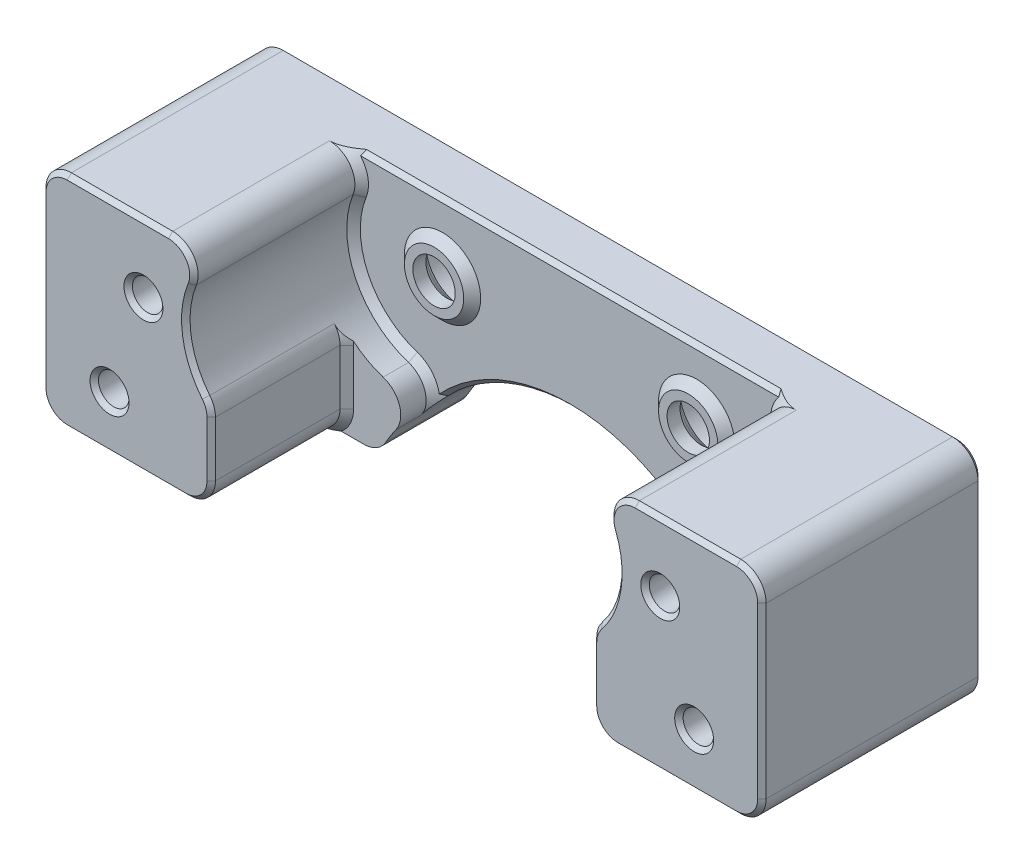
from build123d import *

# Parameters (mm, degrees)
AUFSATZ_LINEAR_AUSTRAGEN1_DEPTH = 10
AUFSATZ_LINEAR_AUSTRAGEN2_DEPTH = 16
SCHNITT_LINEAR_START            = -3.8
SCHNITT_LINEAR_AUSTRAGEN1_DEPTH = 3.8
SKIZZE4_R                       = 2.500000000000343
SKIZZE4_R_2                     = 2.499999999999612
SCHNITT_LINEAR_AUSTRAGEN2_DEPTH = 56.6622852567163
SKIZZE5_R                       = 4.25000000000047
SKIZZE5_R_2                     = 4.250000000000002
SCHNITT_LINEAR_AUSTRAGEN3_DEPTH = 4.8
FASE1_SIZE                      = 0.87
AUFSATZ_LINEAR_START            = 1
SKIZZE6_R                       = 3.500000000000343
SKIZZE6_R_2                     = 2.500000000000343
SKIZZE6_R_3                     = 3.499999999999613
SKIZZE6_R_4                     = 2.499999999999612
AUFSATZ_LINEAR_AUSTRAGEN3_DEPTH = 1
FASE2_SIZE                      = 1
SKIZZE7_R                       = 1.8000000000000005
SKIZZE7_R_2                     = 1.8000000000000007
SKIZZE7_R_3                     = 1.8000000000000047
SKIZZE7_R_4                     = 1.7999999999999936
SCHNITT_LINEAR_AUSTRAGEN4_DEPTH = 59.15711478400557
SKIZZE7_3_R                     = 3.149999999999999
SKIZZE7_3_R_2                   = 1.8000000000000005
SKIZZE7_3_R_3                   = 3.149999999999996
SKIZZE7_3_R_4                   = 1.8000000000000047
SKIZZE7_3_R_5                   = 1.8000000000000007
SKIZZE7_3_R_6                   = 3.1499999999999924
SKIZZE7_3_R_7                   = 1.7999999999999936
SCHNITT_LINEAR_AUSTRAGEN5_DEPTH = 20
FASE3_SIZE                      = 0.67
VERRUNDUNG1_R                   = 3
FASE4_SIZE                      = 0.8
FASE5_SIZE                      = 0.5


# Some blends are built 0.0001 mm under size
with BuildPart() as part:
    # Skizze1 → Aufsatz-Linear austragen1 (new body)
    with BuildSketch(Plane.XY):
        with BuildLine():
            Line((0, 29.999999999999986), (-42.5, 29.999999999999986))
            Line((-42.5, 29.999999999999986), (-42.5, 3.9999999999999862))
            Line((-42.5, 3.9999999999999862), (-18.654758106177756, 3.9999999999999862))
            ThreePointArc((-18.654758106177756, 3.9999999999999862), (-3.26e-14, 16.00000000000006), (18.654758106177756, 3.9999999999999862))
            Line((18.654758106177756, 3.9999999999999862), (42.5, 3.9999999999999862))
            Line((42.5, 3.9999999999999862), (42.5, 29.999999999999986))
            Line((42.5, 29.999999999999986), (0, 29.999999999999986))
        make_face()
    extrude(amount=AUFSATZ_LINEAR_AUSTRAGEN1_DEPTH)

    # Skizze2 → Aufsatz-Linear austragen2 (add)
    with BuildSketch(Plane.XY.offset(10)):
        with BuildLine():
            Line((-42.5, 29.999999999999986), (-42.5, 3.9999999999999862))
            Line((-42.5, 3.9999999999999862), (-22.5, 3.9999999999999862))
            Line((-22.5, 3.9999999999999862), (-22.5, 14.651530771650462))
            ThreePointArc((-22.5, 14.651530771650462), (-25.489119797069538, 22.477876430390648), (-21.800735254367645, 29.999999999999986))
            Line((-21.800735254367645, 29.999999999999986), (-42.5, 29.999999999999986))
        make_face()
        with BuildLine():
            Line((21.800735254367645, 29.999999999999986), (42.5, 29.999999999999986))
            Line((42.5, 29.999999999999986), (42.5, 3.9999999999999862))
            Line((42.5, 3.9999999999999862), (22.5, 3.9999999999999862))
            Line((22.5, 3.9999999999999862), (22.5, 14.651530771650462))
            ThreePointArc((22.5, 14.651530771650462), (25.489119797069538, 22.477876430390655), (21.800735254367645, 29.999999999999986))
        make_face()
    extrude(amount=AUFSATZ_LINEAR_AUSTRAGEN2_DEPTH)

    # Skizze3 → Schnitt-Linear austragen1 (cut)
    with BuildSketch(Plane.XY.offset(10).offset(SCHNITT_LINEAR_START)):
        with BuildLine():
            Line((-21.80073525436765, 29.999999999999986), (21.80073525436765, 29.999999999999986))
            ThreePointArc((21.80073525436765, 29.999999999999986), (25.489119797069538, 22.47787643039065), (22.5, 14.651530771650462))
            ThreePointArc((22.5, 14.651530771650462), (19.067620502353286, 12.319893417485742), (14.999999999999947, 11.499999999999947))
            Line((14.999999999999947, 11.499999999999947), (-14.999999999999947, 11.499999999999947))
            ThreePointArc((-14.999999999999947, 11.499999999999947), (-19.067620502353286, 12.319893417485742), (-22.5, 14.651530771650462))
            ThreePointArc((-22.5, 14.651530771650462), (-25.489119797069538, 22.477876430390648), (-21.80073525436765, 29.999999999999986))
        make_face()
    extrude(amount=SCHNITT_LINEAR_AUSTRAGEN1_DEPTH, mode=Mode.SUBTRACT)

    # Skizze4 → Schnitt-Linear austragen2 (cut, through all)
    with BuildSketch(Plane.XY.offset(6.199999999998522)):
        with Locations((-15.000000000000346, 22.000000000000096)):
            Circle(SKIZZE4_R)
        with Locations((15.000000000000384, 21.999999999999854)):
            Circle(SKIZZE4_R_2)
    extrude(amount=-SCHNITT_LINEAR_AUSTRAGEN2_DEPTH, mode=Mode.SUBTRACT)

    # Skizze5 → Schnitt-Linear austragen3 (cut)
    with BuildSketch(Plane(origin=(0, 0, 0), x_dir=(-1, 0, 0), z_dir=(0, 0, -1))):
        with Locations((-15.000000000000384, 21.99999999999986)):
            Circle(SKIZZE5_R)
        with Locations((14.999999999999947, 21.99999999999997)):
            Circle(SKIZZE5_R_2)
    extrude(amount=-SCHNITT_LINEAR_AUSTRAGEN3_DEPTH, mode=Mode.SUBTRACT)

    # Fase1
    fase1_edges = [part.edges().sort_by_distance(p)[0] for p in [
        (19.250000000000853, 21.99999999999986, 4.8),
        (12.500000000000771, 21.99999999999986, 4.8),
        (-10.749999999999945, 21.99999999999997, 4.8),
        (-17.50000000000069, 22.000000000000103, 4.8),
    ]]
    chamfer(fase1_edges, length=FASE1_SIZE)

    # Skizze6 → Aufsatz-Linear austragen3 (add)
    # profile 1 of 2: a face of its own
    with BuildSketch(Plane.XY.offset(6.199999999998522).offset(AUFSATZ_LINEAR_START)):
        with Locations(Location((-15.000000000000346, 22.000000000000096, 0), (0, 0, 90))):
            Circle(SKIZZE6_R)
        with Locations((-15.000000000000346, 22.000000000000096)):
            Circle(SKIZZE6_R_2, mode=Mode.SUBTRACT)
    # profile 2 of 2: a face of its own
    with BuildSketch(Plane.XY.offset(6.199999999998522).offset(AUFSATZ_LINEAR_START)):
        with Locations(Location((15.000000000000384, 21.999999999999854, 0), (0, 0, 90))):
            Circle(SKIZZE6_R_3)
        with Locations((15.000000000000384, 21.999999999999854)):
            Circle(SKIZZE6_R_4, mode=Mode.SUBTRACT)
    extrude(amount=-AUFSATZ_LINEAR_AUSTRAGEN3_DEPTH)

    # Fase2
    fase2_edges = [part.edges().sort_by_distance(p)[0] for p in [
        (-15.000000000000346, 18.49999999999976, 6.199999999998522),
        (15.000000000000384, 18.50000000000025, 6.199999999998522),
    ]]
    chamfer(fase2_edges, length=FASE2_SIZE - 0.0001)  # a hair under: the kernel refuses the full size

    # Skizze7 → Schnitt-Linear austragen4 (cut, through all)
    with BuildSketch(Plane(origin=(0, 0, 0), x_dir=(-1, 0, 0), z_dir=(0, 0, -1))):
        with Locations((-30.500000000000004, 22)):
            Circle(SKIZZE7_R)
        with Locations((-34.5, 10.373719314951785)):
            Circle(SKIZZE7_R_2)
        with Locations((30.500000000000004, 22.000000000000007)):
            Circle(SKIZZE7_R_3)
        with Locations((34.5, 10.373719314951794)):
            Circle(SKIZZE7_R_4)
    extrude(amount=-SCHNITT_LINEAR_AUSTRAGEN4_DEPTH, mode=Mode.SUBTRACT)

    # Skizze7<3> → Schnitt-Linear austragen5 (cut)
    # profile 1 of 4: a face of its own
    with BuildSketch(Plane(origin=(0, 0, 0), x_dir=(-1, 0, 0), z_dir=(0, 0, -1))):
        with Locations((-30.500000000000004, 22)):
            Circle(SKIZZE7_3_R)
        with Locations((-30.500000000000004, 22)):
            Circle(SKIZZE7_3_R_2, mode=Mode.SUBTRACT)
    # profile 2 of 4: a face of its own
    with BuildSketch(Plane(origin=(0, 0, 0), x_dir=(-1, 0, 0), z_dir=(0, 0, -1))):
        with Locations((30.500000000000004, 22.000000000000007)):
            Circle(SKIZZE7_3_R_3)
        with Locations((30.500000000000004, 22.000000000000007)):
            Circle(SKIZZE7_3_R_4, mode=Mode.SUBTRACT)
    # profile 3 of 4: a face of its own
    with BuildSketch(Plane(origin=(0, 0, 0), x_dir=(-1, 0, 0), z_dir=(0, 0, -1))):
        with Locations((-34.5, 10.373719314951785)):
            Circle(SKIZZE7_3_R)
        with Locations((-34.5, 10.373719314951785)):
            Circle(SKIZZE7_3_R_5, mode=Mode.SUBTRACT)
    # profile 4 of 4: a face of its own
    with BuildSketch(Plane(origin=(0, 0, 0), x_dir=(-1, 0, 0), z_dir=(0, 0, -1))):
        with Locations((34.5, 10.373719314951794)):
            Circle(SKIZZE7_3_R_6)
        with Locations((34.5, 10.373719314951794)):
            Circle(SKIZZE7_3_R_7, mode=Mode.SUBTRACT)
    extrude(amount=-SCHNITT_LINEAR_AUSTRAGEN5_DEPTH, mode=Mode.SUBTRACT)

    # Fase3
    fase3_edges = [part.edges().sort_by_distance(p)[0] for p in [
        (-28.7, 22.000000000000007, 20),
        (-27.35000000000001, 22.000000000000007, 20),
        (36.3, 10.373719314951785, 20),
        (37.65, 10.373719314951785, 20),
        (-32.7, 10.373719314951794, 20),
        (-31.35000000000001, 10.373719314951794, 20),
        (32.300000000000004, 22, 20),
        (33.650000000000006, 22, 20),
    ]]
    chamfer(fase3_edges, length=FASE3_SIZE)

    # Verrundung1
    # the kernel refuses this fillet: 3 mm, written as the material it takes off along each edge
    with BuildSketch(Plane(origin=(22.5, 3.9999999999999862, 10), x_dir=(1, -1.5e-16, 0), z_dir=(0, 0, 1))) as verrundung1_piece_1:
        with BuildLine():
            CenterArc((VERRUNDUNG1_R, VERRUNDUNG1_R), VERRUNDUNG1_R, 180, 90)
            Line((-4.4e-16, VERRUNDUNG1_R), (0, 0))
            Line((0, 0), (VERRUNDUNG1_R, 0))
        make_face()
    extrude(amount=23.5, mode=Mode.SUBTRACT)
    with BuildSketch(Plane(origin=(18.65475810617776, 3.9999999999999893, -4.597858564353903), x_dir=(-0.4523951415061349, 0.8918176023950436, 0), z_dir=(0, 0, 1))) as verrundung1_piece_2:
        with BuildLine():
            CenterArc((1.843433256846694, -2.9973659049238517), VERRUNDUNG1_R, 92.40117884405109, 60.70136326071929)
            Line((-0.8320195503384352, -1.6401804804054438), (0, 0))
            ThreePointArc((0, 0), (0.8588723128490288, -0.01799964968701035), (1.7177446256980617, -1e-16))
        make_face()
    extrude(amount=19.195717128707805, mode=Mode.SUBTRACT)
    with BuildSketch(Plane(origin=(-18.65475810617776, 3.9999999999999862, -4.5978585643539205), x_dir=(-1, -2.4e-16, 0), z_dir=(0, 0, 1))) as verrundung1_piece_3:
        with BuildLine():
            CenterArc((1.8391434257415675, -3), VERRUNDUNG1_R, 89.99999999999999, 60.70136326071939)
            ThreePointArc((-0.7770993230140743, -1.531914893617022), (-0.3724972570792177, -0.7741004008757256), (0, 0))
            Line((0, 0), (1.8391434257415682, 0))
        make_face()
    extrude(amount=19.19571712870784, mode=Mode.SUBTRACT)
    with BuildSketch(Plane(origin=(-22.5, 3.9999999999999862, 10), x_dir=(0, 1, 0), z_dir=(0, 0, 1))) as verrundung1_piece_4:
        with BuildLine():
            CenterArc((VERRUNDUNG1_R, VERRUNDUNG1_R), VERRUNDUNG1_R, 180, 90)
            Line((-4.4e-16, VERRUNDUNG1_R), (0, 0))
            Line((0, 0), (VERRUNDUNG1_R, 0))
        make_face()
    extrude(amount=23.5, mode=Mode.SUBTRACT)
    with BuildSketch(Plane(origin=(-22.5, 14.65153077165046, 10), x_dir=(-0.6649550224740771, 0.7468834032742324, 0), z_dir=(0, 0, 1))) as verrundung1_piece_5:
        with BuildLine():
            CenterArc((1.1457989430171323, 2.9965791558411374), VERRUNDUNG1_R, 228.3211250669131, 38.94244126898127)
            Line((-0.8490661244051058, 0.755928946018446), (0, 0))
            ThreePointArc((0, 0), (0.5012870375699956, 0.01197295455602352), (1.002574075139996, -4e-17))
        make_face()
    extrude(amount=18.842030364722625, mode=Mode.SUBTRACT)
    with BuildSketch(Plane(origin=(22.5, 14.65153077165046, 10), x_dir=(0.6649550224740782, 0.7468834032742312, 0), z_dir=(0, 0, 1))) as verrundung1_piece_6:
        with BuildLine():
            CenterArc((1.1457989430171456, -2.9965791558411365), VERRUNDUNG1_R, 92.7364336641057, 38.94244126898133)
            Line((-0.849066124405097, -0.7559289460184502), (0, 0))
            ThreePointArc((0, 0), (0.5012870375699969, -0.01197295455602155), (1.0025740751400045, -8e-17))
        make_face()
    extrude(amount=18.842030364722614, mode=Mode.SUBTRACT)
    with BuildSketch(Plane(origin=(42.5, 3.9999999999999862, -7.499999999999999), x_dir=(0, 1, 0), z_dir=(0, 0, 1))) as verrundung1_piece_7:
        with BuildLine():
            CenterArc((VERRUNDUNG1_R, VERRUNDUNG1_R), VERRUNDUNG1_R, 180, 90)
            Line((-4.4e-16, VERRUNDUNG1_R), (0, 0))
            Line((0, 0), (VERRUNDUNG1_R, 0))
        make_face()
    extrude(amount=41, mode=Mode.SUBTRACT)
    with BuildSketch(Plane(origin=(-42.5, 3.999999999999986, 33.5), x_dir=(0, 1, 0), z_dir=(0, 0, -1))) as verrundung1_piece_8:
        with BuildLine():
            CenterArc((VERRUNDUNG1_R, VERRUNDUNG1_R), VERRUNDUNG1_R, 180, 90)
            Line((0, VERRUNDUNG1_R), (0, 0))
            Line((0, 0), (VERRUNDUNG1_R, 0))
        make_face()
    extrude(amount=41, mode=Mode.SUBTRACT)
    with BuildSketch(Plane(origin=(42.5, 29.999999999999986, -7.499999999999999), x_dir=(-1, 0, 0), z_dir=(0, 0, 1))) as verrundung1_piece_9:
        with BuildLine():
            CenterArc((VERRUNDUNG1_R, VERRUNDUNG1_R), VERRUNDUNG1_R, 180, 90)
            Line((0, VERRUNDUNG1_R), (0, 0))
            Line((0, 0), (VERRUNDUNG1_R, 0))
        make_face()
    extrude(amount=41, mode=Mode.SUBTRACT)
    with BuildSketch(Plane(origin=(-42.5, 29.999999999999986, -7.499999999999999), x_dir=(1, 0, 0), z_dir=(0, 0, 1))) as verrundung1_piece_10:
        with BuildLine():
            CenterArc((VERRUNDUNG1_R, -VERRUNDUNG1_R), VERRUNDUNG1_R, 90, 90)
            Line((0, -VERRUNDUNG1_R), (0, 0))
            Line((0, 0), (VERRUNDUNG1_R, 0))
        make_face()
    extrude(amount=41, mode=Mode.SUBTRACT)
    with BuildSketch(Plane(origin=(-21.80073525436761, 29.999999999999986, 40.34800237404184), x_dir=(-1, 0, 1.8e-16), z_dir=(-1.8e-16, 0, -1))) as verrundung1_piece_11:
        with BuildLine():
            CenterArc((5.739200949616773, -3), VERRUNDUNG1_R, 90, 111.73846079152068)
            ThreePointArc((2.952548459842454, -4.111111111111121), (1.727699223599764, -1.8749852771592543), (0, 0))
            Line((0, 0), (5.739200949616773, 0))
        make_face()
    extrude(amount=34.14800237404184, mode=Mode.SUBTRACT)
    with BuildSketch(Plane(origin=(21.800735254367655, 29.999999999999986, 40.34800237404188), x_dir=(1, 0, 3.6e-16), z_dir=(3.6e-16, 0, -1))) as verrundung1_piece_12:
        with BuildLine():
            CenterArc((5.739200949616741, 3), VERRUNDUNG1_R, 158.26153920847946, 111.73846079152054)
            ThreePointArc((2.9525484598424185, 4.111111111111114), (1.7276992235997461, 1.8749852771592543), (0, 0))
            Line((0, 0), (5.739200949616741, 0))
        make_face()
    extrude(amount=34.14800237404188, mode=Mode.SUBTRACT)
    with BuildSketch(Plane(origin=(-12.816005617976494, 11.499999999999947, 24.08995299864942), x_dir=(-0.9956736487572149, 0.09291924004475213, 0), z_dir=(0, 0, -1))) as verrundung1_piece_13:
        with BuildLine():
            CenterArc((6.069056233511456, -2.9290394896317506), VERRUNDUNG1_R, 102.48662742722865, 107.68493153871188)
            Line((3.475483065378992, -4.4368120923617935), (3.216125748565745, -4.587589352634797))
            ThreePointArc((3.216125748565745, -4.587589352634797), (1.6547741109386078, -2.2833968240796914), (-0.20849658902721374, -0.21570621772220028))
            Line((-0.20849658902721374, -0.21570621772220028), (0.02787577201342571, 0.2987020946271652))
            ThreePointArc((0.02787577201342571, 0.2987020946271652), (2.202421427227976, 0.09576699638753784), (5.3555574749315245, 0.2929039489631753))
            Line((5.3555574749315245, 0.2929039489631753), (5.42042099843879, 1e-17))
        make_face()
    extrude(amount=17.88995299864942, mode=Mode.SUBTRACT)
    with BuildSketch(Plane(origin=(12.816005617976488, 11.499999999999945, 24.089952998649423), x_dir=(0.6871407081901991, -0.7265243610147367, 0), z_dir=(0, 0, -1))) as verrundung1_piece_14:
        with BuildLine():
            CenterArc((6.0483700677129235, -2.9715207253762985), VERRUNDUNG1_R, 97.90106492608787, 107.68493153871174)
            Line((3.342555753930557, -4.267116688371888), (3.0719743225523213, -4.396676284671448))
            ThreePointArc((3.0719743225523213, -4.396676284671448), (1.282754138042594, -1.7928673353164282), (-0.21795730830442153, -0.20614221245706021))
            Line((-0.21795730830442153, -0.20614221245706021), (0.0412388868253141, 0.2971520725376302))
            ThreePointArc((0.0412388868253141, 0.2971520725376302), (2.817990599729887, 0.10539162340470797), (5.5947423126344535, 0.2971520725376298))
            Line((5.5947423126344535, 0.2971520725376298), (5.635981199459769, -6e-17))
        make_face()
    extrude(amount=17.889952998649424, mode=Mode.SUBTRACT)

    # Fase4
    # the kernel refuses this chamfer: 0.8 mm, written as the material it adds along each edge
    with BuildSketch(Plane(origin=(22.5, 7, 10), x_dir=(-0.9996219169112966, 0, -0.027495876610587302), z_dir=(0, 1, 0))) as fase4_piece_1:
        Polygon((FASE4_SIZE * 0.999621916911, FASE4_SIZE * 0.0274958766106), (-FASE4_SIZE * 0.0274958766106, FASE4_SIZE * 0.999621916911), (0, 0), align=None)
    extrude(amount=6.514718625761132)
    with BuildSketch(Plane(origin=(-22.5, 7, 10), x_dir=(0.9996219169112966, 0, -0.02749587661058718), z_dir=(0, 1, 0))) as fase4_piece_2:
        Polygon((FASE4_SIZE * 0.999621916911, -FASE4_SIZE * 0.0274958766106), (-FASE4_SIZE * 0.0274958766106, -FASE4_SIZE * 0.999621916911), (0, 0), align=None)
    extrude(amount=6.514718625761132)
    with BuildSketch(Plane(origin=(-14.99999999999993, 21.999999999999954, 6.2), x_dir=(-0.9288841632581083, 0.3703703703703683, 0), z_dir=(0.3703703703703683, 0.9288841632581083, 0))) as fase4_piece_3:
        Polygon((10.50000000000002 - FASE4_SIZE, -4.44e-15), (10.500000000000009, FASE4_SIZE), (10.50000000000002, 0), align=None)
    revolve(axis=Axis((-14.99999999999993, 21.999999999999954, 6.2), (0, 0, 1)), revolution_arc=93.92026210428077)
    with BuildSketch(Plane(origin=(14.999999999999961, 21.999999999999925, 6.2), x_dir=(0.3059977115515767, -0.952032247628828, 0), z_dir=(-0.952032247628828, -0.3059977115515767, 0))) as fase4_piece_4:
        Polygon((10.499999999999979 - FASE4_SIZE, -4.44e-15), (10.499999999999979, FASE4_SIZE), (10.499999999999979, 0), align=None)
    revolve(axis=Axis((14.999999999999961, 21.999999999999925, 6.2), (0, 0, 1)), revolution_arc=93.92026210428381)
    with BuildSketch(Plane(origin=(25.5, 7, 10), x_dir=(-1, 0, 0), z_dir=(0, 1, 0))) as fase4_piece_5_section:
        Polygon((3, FASE4_SIZE), (3 + FASE4_SIZE, 0), (3, 0), align=None)
    fase4_piece_5 = revolve(axis=Axis((25.5, 7, 10), (0, 0, 1)), revolution_arc=129.30820580784453, mode=Mode.PRIVATE)
    fase4_piece_5 = split(fase4_piece_5, bisect_by=Plane(origin=(23.313475846129947, 3.9999999999999862, 10.294769350483795), z_dir=(0, 1, 0)), keep=Keep.TOP, mode=Mode.PRIVATE)
    add(fase4_piece_5)
    with BuildSketch(Plane(origin=(-25.5, 7, 10), x_dir=(-0.633491694260731, -0.7737494900177114, 0), z_dir=(-0.7737494900177114, 0.633491694260731, 0))) as fase4_piece_6_section:
        Polygon((3.0000000000017613 + FASE4_SIZE, 0), (3.0000000000000004, FASE4_SIZE), (3.0000000000017613, 0), align=None)
    fase4_piece_6 = revolve(axis=Axis((-25.5, 7, 10), (0, 0, 1)), revolution_arc=129.30820580784453, mode=Mode.PRIVATE)
    fase4_piece_6 = split(fase4_piece_6, bisect_by=Plane(origin=(-23.313475846129677, 3.9999999999999862, 10.294769350483918), z_dir=(0, 1, 0)), keep=Keep.TOP, mode=Mode.PRIVATE)
    add(fase4_piece_6)
    with BuildSketch(Plane(origin=(-25.499999999999684, 13.514718625760661, 10), x_dir=(1, 9.237e-14, 0), z_dir=(9.237e-14, -1, 0))) as fase4_piece_7_section:
        Polygon((3 + FASE4_SIZE, 0), (3, FASE4_SIZE), (3, 0), align=None)
    fase4_piece_7 = revolve(axis=Axis((-25.499999999999684, 13.514718625760661, 10), (0, 0, 1)), revolution_arc=78.23781747382799, mode=Mode.PRIVATE)
    fase4_piece_7 = fase4_piece_7 - Plane(origin=(-14.999999999999956, 21.99999999999994, 10.26459173598739), x_dir=(8.5e-16, -1, 0), z_dir=(0, 0, -1)) * Cylinder(10.499999999999993, 16, mode=Mode.PRIVATE)
    add(fase4_piece_7)
    with BuildSketch(Plane(origin=(25.499999999999684, 13.514718625760661, 10), x_dir=(-0.20384991626770702, 0.9790021509872431, 0), z_dir=(0.9790021509872431, 0.20384991626770702, 0))) as fase4_piece_8_section:
        Polygon((3.000000000002359 + FASE4_SIZE, 0), (3.0000000000000004, FASE4_SIZE), (3.000000000002359, 0), align=None)
    fase4_piece_8 = revolve(axis=Axis((25.499999999999684, 13.514718625760661, 10), (0, 0, 1)), revolution_arc=78.23781747382799, mode=Mode.PRIVATE)
    fase4_piece_8 = fase4_piece_8 - Plane(origin=(14.999999999999943, 21.999999999999957, 10.37029425899956), x_dir=(0.6476890718445427, 0.7619047619047639, 0), z_dir=(0, 0, -1)) * Cylinder(10.500000000000012, 16, mode=Mode.PRIVATE)
    add(fase4_piece_8)
    with BuildSketch(Plane(origin=(-27.539936203985, 27, 6.199999999999996), x_dir=(-0.6336071435722456, 0.7736549538484322, 0), z_dir=(-0.7736549538484322, -0.6336071435722456, 0))) as fase4_piece_9_section:
        Polygon((3.000000000000809 + FASE4_SIZE, 0), (3.000000000000001, -FASE4_SIZE), (3.000000000000809, 0), align=None)
    fase4_piece_9 = revolve(axis=Axis((-27.539936203985, 27, 6.199999999999996), (0, 0, -1)), revolution_arc=151.05521608791258, mode=Mode.PRIVATE)
    fase4_piece_9 = split(fase4_piece_9, bisect_by=Plane(origin=(-25.0103402786428, 29.999999999999986, 6.481629553944198), z_dir=(0, -1, 0)), keep=Keep.TOP, mode=Mode.PRIVATE)
    add(fase4_piece_9)
    with BuildSketch(Plane(origin=(27.539936203985, 27, 6.199999999999996), x_dir=(-0.9288841632581042, -0.3703703703703786, 0), z_dir=(0.3703703703703786, -0.9288841632581042, 0))) as fase4_piece_10_section:
        Polygon((2.9999999999999987 + FASE4_SIZE, 0), (2.9999999999999987, -FASE4_SIZE), (2.9999999999999987, 0), align=None)
    fase4_piece_10 = revolve(axis=Axis((27.539936203985, 27, 6.199999999999996), (0, 0, -1)), revolution_arc=151.05521608791238, mode=Mode.PRIVATE)
    fase4_piece_10 = split(fase4_piece_10, bisect_by=Plane(origin=(24.276778976488867, 29.999999999999986, 6.42609566844091), z_dir=(0, -1, 0)), keep=Keep.TOP, mode=Mode.PRIVATE)
    add(fase4_piece_10)
    with BuildSketch(Plane(origin=(19.130969105945795, 9.147564657008816, 6.199999999999999), x_dir=(-0.26188344742622144, -0.9650995078043287, 0), z_dir=(0.9650995078043287, -0.26188344742622144, 0))) as fase4_piece_11_section:
        Polygon((3.0000000000000004, -FASE4_SIZE), (3.0000000000000013 + FASE4_SIZE, 3.55e-15), (3.0000000000000013, 3.55e-15), align=None)
    fase4_piece_11 = revolve(axis=Axis((19.130969105945795, 9.147564657008816, 6.199999999999999), (0, 0, -1)), revolution_arc=146.99995266543996, mode=Mode.PRIVATE)
    fase4_piece_11 = fase4_piece_11 - Plane(origin=(-1.78e-15, -4.5000000000000835, 6.481486488336465), x_dir=(-0.9099882003013476, 0.414634146341464, 0), z_dir=(0, 0, -1)) * Cylinder(20.500000000000142, 16, mode=Mode.PRIVATE)
    add(fase4_piece_11)
    with BuildSketch(Plane(origin=(-19.130969105946917, 9.147564657012529, 6.199999999999999), x_dir=(0.305997711551908, 0.9520322476287215, 0), z_dir=(-0.9520322476287215, 0.305997711551908, 0))) as fase4_piece_12_section:
        Polygon((2.9999999999999996 + FASE4_SIZE, 3.55e-15), (3.000000000000001, -FASE4_SIZE), (2.9999999999999996, 0), align=None)
    fase4_piece_12 = revolve(axis=Axis((-19.130969105946917, 9.147564657012529, 6.199999999999999), (0, 0, -1)), revolution_arc=146.99995266543982, mode=Mode.PRIVATE)
    fase4_piece_12 = fase4_piece_12 - Plane(origin=(-1.78e-15, -4.5000000000000835, 6.426095643449497), x_dir=(-0.9099882003013476, 0.414634146341464, 0), z_dir=(0, 0, -1)) * Cylinder(20.500000000000142, 16, mode=Mode.PRIVATE)
    add(fase4_piece_12)

    # Fase5
    fase5_edges = [part.edges().sort_by_distance(p)[0] for p in [
        (-32.7, 10.373719314951794, 26),
        (-28.7, 22.000000000000007, 26),
        (36.3, 10.373719314951785, 26),
        (32.300000000000004, 22, 26),
        (-27.35000000000001, 22.000000000000007, 0),
        (37.65, 10.373719314951785, 0),
        (-31.35000000000001, 10.373719314951794, 0),
        (33.650000000000006, 22, 0),
        (29.996950765959625, 3.9999999999999862, 0),
        (32.5, 3.9999999999999862, 26),
        (22.5, 10.257359312880565, 26),
        (42.5, 17, 26),
        (33.519968101992504, 29.999999999999986, 26),
        (25.381887454659857, 20.42951826537986, 26),
        (25.056658799693103, 28.683250823060334, 26),
        (41.621320343559645, 29.121320343559642, 26),
        (41.621320343559645, 4.878679656440358, 26),
        (22.67157287525358, 14.514718625760912, 26),
        (23.378679656440358, 4.878679656440357, 26),
        (0, 29.999999999999986, 0),
        (42.5, 17, 0),
        (-2.176e-13, 16.000000000000057, 0),
        (-29.99695076596, 3.9999999999999862, 0),
        (-42.5, 17, 0),
        (-41.621320343559645, 29.121320343559642, 0),
        (41.621320343559645, 29.121320343559642, 0),
        (-41.621320343559645, 4.878679656440358, 0),
        (41.621320343559645, 4.878679656440358, 0),
        (-18.978028074000278, 4.411153218211921, 0),
        (18.978028073999855, 4.4111532182122355, 0),
        (-32.5, 3.9999999999999862, 26),
        (-22.5, 10.257359312880565, 26),
        (-42.5, 17, 26),
        (-25.381887454659854, 20.429518265379855, 26),
        (-33.519968101992504, 29.999999999999986, 26),
        (-25.056658799693103, 28.683250823060334, 26),
        (-41.621320343559645, 29.121320343559642, 26),
        (-41.621320343559645, 4.878679656440358, 26),
        (-22.67157287525358, 14.514718625760912, 26),
        (-23.378679656440358, 4.878679656440358, 26),
        (-7.9403e-13, 16.000000000000057, 6.199999999999999),
        (8.1712e-13, 30, 6.199999999999996),
        (19.250000000000853, 21.99999999999986, 0),
        (-10.749999999999945, 21.99999999999997, 0),
    ]]
    chamfer(fase5_edges, length=FASE5_SIZE)


solid = part.part
